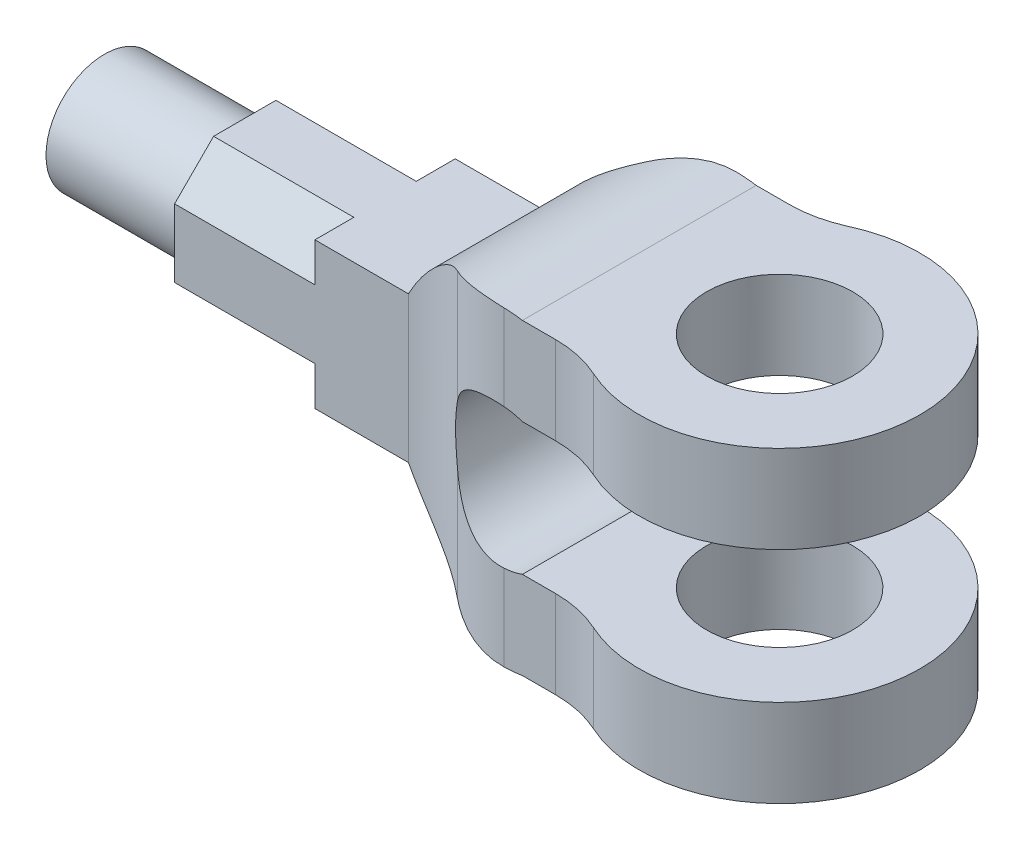
from build123d import *

# Parameters (mm, degrees)
SKETCH4_R               = 12
SKETCH4_R_2             = 6.25
BOSS_EXTRUDE2_DEPTH     = 7.5
BOSS_EXTRUDE3_DEPTH     = 10
SKETCH6_R               = 6.25
CUT_EXTRUDE1_DEPTH      = 20
SKETCH7_W               = 20
SKETCH7_H               = 7.5
BOSS_EXTRUDE4_DEPTH     = 5.36675
CUT_EXTRUDE2_DEPTH      = 50.133277179
CUT_EXTRUDE2_DEPTH_BACK = 50.133277179
FILLET1_R               = 10
FILLET2_R               = 10
CUT_EXTRUDE3_DEPTH      = 12
SKETCH10_R              = 5
BOSS_EXTRUDE5_DEPTH     = 12
FILLET3_R               = 10


with BuildPart() as part:
    # Sketch4 → Boss-Extrude2 (new body)
    with BuildSketch(Plane(origin=(0, 0, 0), x_dir=(1, 0, 0), z_dir=(0, 1, 0))):
        with Locations(Location((0, 0, 0), (0, 0, 270))):
            Circle(SKETCH4_R)
        with Locations(Location((0, 0, 0), (0, 0, 270))):
            Circle(SKETCH4_R_2, mode=Mode.SUBTRACT)
    extrude(amount=BOSS_EXTRUDE2_DEPTH)

    # Sketch5 → Boss-Extrude3 (add, symmetric)
    with BuildSketch(Plane.XY):
        with BuildLine():
            Line((-25.749055866, 0.593145751), (-45.749055866, 0.593145751))
            Line((-45.749055866, 0.593145751), (-45.749055866, -5.656854249))
            Line((-45.749055866, -5.656854249), (-20, -5.656854249))
            ThreePointArc((-20, -5.656854249), (-17.464101615, -0.757874764), (-12, 0))
            Line((-12, 0), (12, 0))
            Line((12, 0), (12, 7.5))
            Line((12, 7.5), (-12, 7.5))
            ThreePointArc((-12, 7.5), (-19.973874913, 6.234976235), (-25.749055866, 0.593145751))
        make_face()
    extrude(amount=BOSS_EXTRUDE3_DEPTH, both=True)

    # Sketch6 → Cut-Extrude1 (cut)
    with BuildSketch(Plane.XZ):
        with BuildLine():
            Line((6.633249581, -10), (12, -10))
            Line((12, -10), (12, 0))
            ThreePointArc((12, 0), (10.573528147, -5.674548662), (6.633249581, -10))
        make_face()
        with BuildLine():
            ThreePointArc((6.633249581, 10), (10.573528147, 5.674548662), (12, 0))
            Line((12, 0), (12, 10))
            Line((12, 10), (6.633249581, 10))
        make_face()
        with BuildLine():
            Line((-12, -10), (-6.633249581, -10))
            ThreePointArc((-6.633249581, -10), (-10.573528147, -5.674548662), (-12, 0))
            Line((-12, 0), (-12, -10))
        make_face()
        with BuildLine():
            ThreePointArc((-12, 0), (-10.573528147, 5.674548662), (-6.633249581, 10))
            Line((-6.633249581, 10), (-12, 10))
            Line((-12, 10), (-12, 0))
        make_face()
        with Locations(Location((0, 0, 0), (0, 0, 270))):
            Circle(SKETCH6_R)
    extrude(amount=-CUT_EXTRUDE1_DEPTH, mode=Mode.SUBTRACT)


with BuildPart() as cut_extrude1_piece_1:
    # of the separate pieces the step leaves, piece 1, a body of its own (cut_extrude1_pieces)
    add(part.part.solids().sort_by_distance((-45.749055866, -5.656854249, 10))[0])



with BuildPart() as cut_extrude1_piece_2:
    # of the separate pieces the step leaves, piece 2, a body of its own (cut_extrude1_pieces)
    add(part.part.solids().sort_by_distance((-6.633249581, 0, 10))[0])


with BuildPart() as cut_extrude1_piece_1_1:
    add(cut_extrude1_piece_1.part)

    add(cut_extrude1_piece_2.part)  # Boss-Extrude4 merges Cut-Extrude1 piece 2
    # Sketch7 → Boss-Extrude4 (add)
    with BuildSketch(Plane(origin=(-12, 0, 0), x_dir=(0, 0, -1), z_dir=(1, 0, 0))):
        with Locations((0, 3.75)):
            Rectangle(SKETCH7_W, SKETCH7_H)
    extrude(amount=BOSS_EXTRUDE4_DEPTH)

    # Mirror2: Cut-Extrude1 piece 1 across plane


with BuildPart() as cut_extrude1_piece_1_2:
    add(cut_extrude1_piece_1_1.part)
    add(cut_extrude1_piece_1_1.part.mirror(Plane(origin=(-45.749055866, -5.656854249, 10), x_dir=(0, 0, 1), z_dir=(0, 1, 0))))

    # Sketch8 → Cut-Extrude2 (cut, two sides: drawn at the far end of the back side and taken through both)
    with BuildSketch(Plane(origin=(0, -5.656854249, 0), x_dir=(-1, 0, 0), z_dir=(0, -1, 0)).offset(-CUT_EXTRUDE2_DEPTH_BACK)):
        with BuildLine():
            ThreePointArc((17.507339718, 10), (21.168502268, 7.052829994), (25.749055866, 6))
            Line((25.749055866, 6), (45.749055866, 6))
            Line((45.749055866, 6), (45.749055866, 10))
            Line((45.749055866, 10), (17.507339718, 10))
        make_face()
        with BuildLine():
            Line((45.749055866, -10), (45.749055866, -6))
            Line((45.749055866, -6), (25.749055866, -6))
            ThreePointArc((25.749055866, -6), (21.168502268, -7.052829994), (17.507339718, -10))
            Line((17.507339718, -10), (45.749055866, -10))
        make_face()
    extrude(amount=CUT_EXTRUDE2_DEPTH + CUT_EXTRUDE2_DEPTH_BACK, mode=Mode.SUBTRACT)

    # Fillet1
    # the kernel refuses this fillet: 10 mm, written as the material it takes off along each edge
    with BuildSketch(Plane(origin=(-17.507339718, -28.296259364, -10), x_dir=(1, 0, 0), z_dir=(0, 1, 0)), Plane(origin=(-17.507339718, -10.590642804, -10), x_dir=(1, 0, 0), z_dir=(0, 1, 0))) as fillet1_piece_1:
        with BuildLine():
            CenterArc((3.920762426, -10), FILLET1_R, 90, 36.410037128)
            ThreePointArc((-2.014836369, -1.952101707), (-0.941870787, -1.043704746), (0, 0))
            Line((0, 0), (3.920762426, 0))
        make_face()
    extrude(amount=27.573193669, mode=Mode.SUBTRACT)

    # Fillet2
    # the kernel refuses this fillet: 10 mm, written as the material it takes off along each edge
    with BuildSketch(Plane(origin=(-17.507339718, -10.590642804, 10), x_dir=(-0.718199432618455, 0, -0.6958373193401812), z_dir=(0, 1, 0))) as fillet2_piece_1:
        with BuildLine():
            CenterArc((4.142483844, -9.910207143), FILLET2_R, 97.683941218, 36.410037128)
            Line((-2.81588935, -2.728212816), (0, 0))
            ThreePointArc((0, 0), (1.402699778, -0.094199313), (2.805399556, 0))
        make_face()
    extrude(amount=27.573193669, mode=Mode.SUBTRACT)
    with BuildSketch(Plane(origin=(-17.507339718, -28.296259364, 10), x_dir=(1, 0, 0), z_dir=(0, 1, 0))) as fillet2_piece_2:
        with BuildLine():
            CenterArc((3.920762426, 10), FILLET2_R, 233.589962872, 36.410037128)
            ThreePointArc((-2.014836369, 1.952101707), (-0.941870787, 1.043704746), (0, 0))
            Line((0, 0), (3.920762426, 0))
        make_face()
    extrude(amount=27.573193669, mode=Mode.SUBTRACT)

    # Sketch9 → Cut-Extrude3 (cut)
    with BuildSketch(Plane.ZY.offset(45.749055866)):
        Polygon((-6, -2.740187583), (-2.666666667, 0.593145751), (-6, 0.593145751), align=None)
        Polygon((6, 0.593145751), (2.666666667, 0.593145751), (6, -2.740187583), align=None)
        Polygon((6, -8.573520916), (6, -11.906854249), (2.666666667, -11.906854249), align=None)
        Polygon((-6, -8.573520916), (-6, -11.906854249), (-2.666666667, -11.906854249), align=None)
    extrude(amount=-CUT_EXTRUDE3_DEPTH, mode=Mode.SUBTRACT)

    # Sketch10 → Boss-Extrude5 (add)
    with BuildSketch(Plane.ZY.offset(45.749055866)):
        with Locations((0, -5.656854249)):
            Circle(SKETCH10_R)
    extrude(amount=BOSS_EXTRUDE5_DEPTH)

    # Fillet3
    fillet3_edges = [cut_extrude1_piece_1_2.edges().sort_by_distance(p)[0] for p in [
        (-6.633249581, 3.75, 10),
        (-6.633249581, 3.75, -10),
        (-6.633249581, -15.063708499, -10),
        (-6.633249581, -15.063708499, 10),
    ]]
    fillet(fillet3_edges, radius=FILLET3_R)


solid = cut_extrude1_piece_1_2.part
